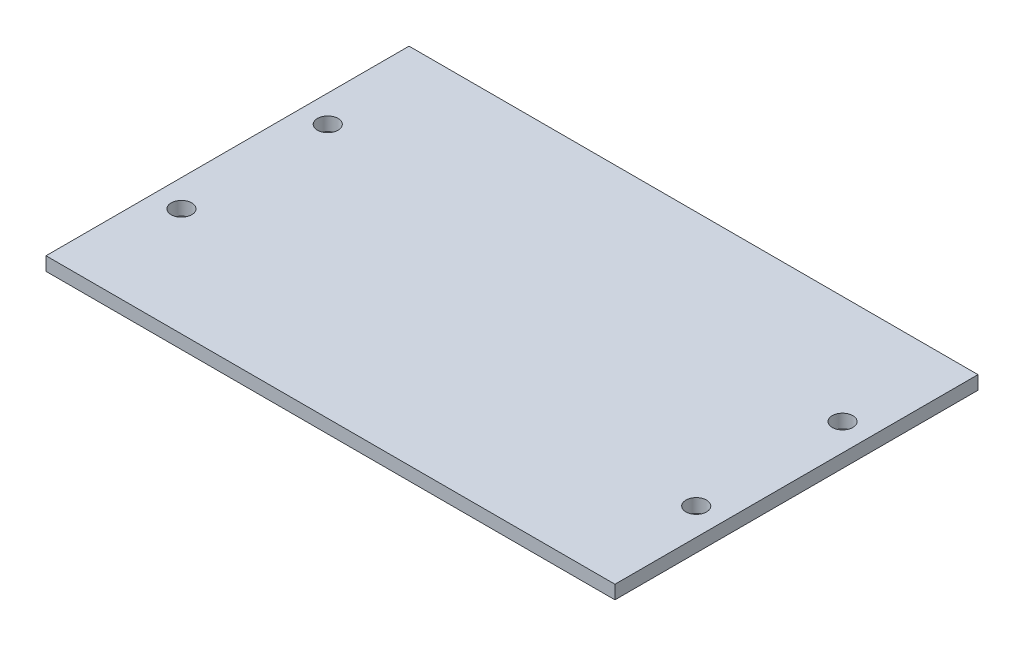
from build123d import *

# Parameters (mm, degrees)
SKETCH1_W           = 133.35
SKETCH1_H           = 85.09
BOSS_EXTRUDE1_DEPTH = 3.175
SKETCH2_R           = 2.413
CUT_EXTRUDE1_DEPTH  = 101.267182843


with BuildPart() as part:
    # Sketch1 → Boss-Extrude1 (new body)
    with BuildSketch(Plane(origin=(0, 0, 0), x_dir=(1, 0, 0), z_dir=(0, 1, 0))):
        with Locations((21.486627907, 5.109534884)):
            Rectangle(SKETCH1_W, SKETCH1_H)
    extrude(amount=BOSS_EXTRUDE1_DEPTH)

    # Sketch2 → Cut-Extrude1 (cut, through all)
    with BuildSketch(Plane(origin=(0, 3.175, 0), x_dir=(1, 0, 0), z_dir=(0, 1, 0))):
        with Locations((81.811627907, -12.035465116)):
            Circle(SKETCH2_R)
        with Locations((81.811627907, 22.254534884)):
            Circle(SKETCH2_R)
        with Locations((-38.838372093, 22.254534884)):
            Circle(SKETCH2_R)
        with Locations((-38.838372093, -12.035465116)):
            Circle(SKETCH2_R)
    extrude(amount=-CUT_EXTRUDE1_DEPTH, mode=Mode.SUBTRACT)


solid = part.part
